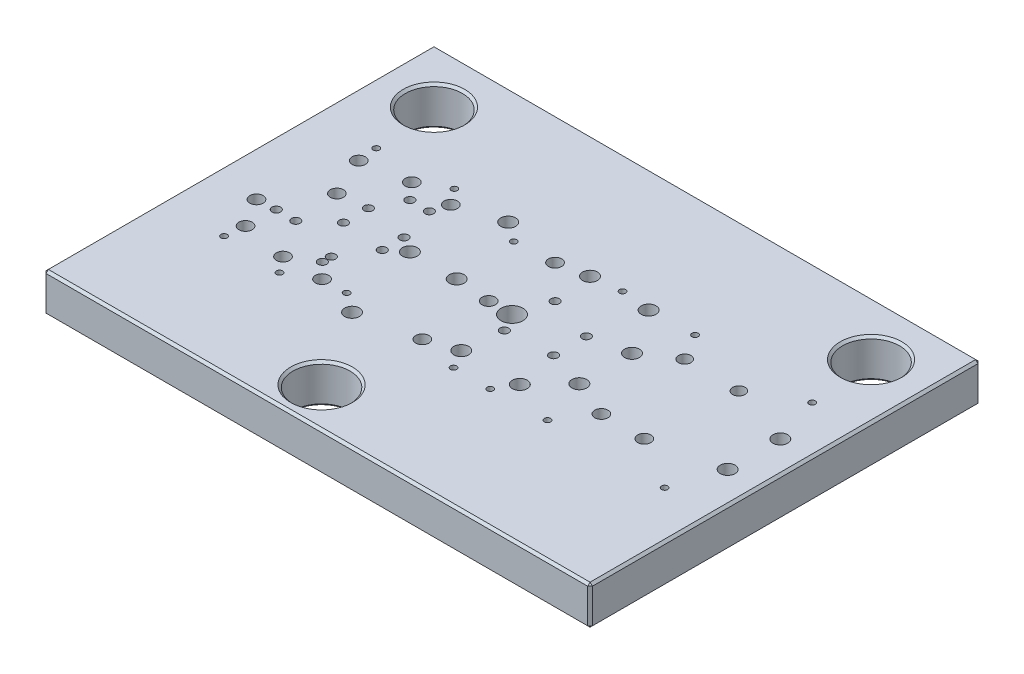
from build123d import *

# Parameters (mm, degrees)
SKETCH1_W                  = 700
SKETCH1_H                  = 500
BOSS_EXTRUDE1_DEPTH        = 50
CUT_EXTRUDE1_REACH         = 435.013
SKETCH2_R                  = 36.5
CHAMFER1_SIZE              = 3
CHAMFER2_SIZE              = 3
M30X2_0_TAPPED_HOLE1_D     = 28
CUT_EXTRUDE2_REACH         = 435.013
SKETCH7_R                  = 6
CUT_EXTRUDE3_REACH         = 435.013
SKETCH8_R                  = 8.5
CUT_EXTRUDE4_REACH         = 435.013
SKETCH9_R                  = 8
SKETCH11_R                 = 9.5
CUT_EXTRUDE5_DEPTH         = 36.8
M10_TAPPED_HOLE1_D         = 8.5
M10_TAPPED_HOLE1_DEPTH     = 27.5
M10_TAPPED_HOLE1_TIP       = 2.553657631
F_8_0MM_DOWEL_HOLE1_D      = 8
M8_TAPPED_HOLE1_D          = 6.8
M8_TAPPED_HOLE1_DEPTH      = 22.25
M8_TAPPED_HOLE1_TIP        = 2.042926105
F_8_0MM_DOWEL_HOLE2_D      = 8
F_11_0_11_DIAMETER_HOLE1_D = 11
SKETCH27_R                 = 6
CUT_EXTRUDE6_DEPTH         = 434.012701892
SKETCH29_R                 = 9.5
CUT_EXTRUDE7_DEPTH         = 36.8
SKETCH30_R                 = 5
CUT_EXTRUDE8_DEPTH         = 434.012701892
SKETCH31_R                 = 8.5
CUT_EXTRUDE9_DEPTH         = 39.8
M8_TAPPED_HOLE2_D          = 6.8
M8_TAPPED_HOLE2_DEPTH      = 22.25
M8_TAPPED_HOLE2_TIP        = 2.042926105
F_8_0MM_DOWEL_HOLE3_D      = 8
SKETCH38_R                 = 6
CUT_EXTRUDE10_DEPTH        = 434.012701892
SKETCH39_R                 = 9.5
CUT_EXTRUDE11_DEPTH        = 36.8
SKETCH40_R                 = 10
CUT_EXTRUDE12_DEPTH        = 9.2
F_10_0_10_DIAMETER_HOLE1_D = 10
SKETCH45_R                 = 8.5
CUT_EXTRUDE13_DEPTH        = 33.8
F_11_0_11_DIAMETER_HOLE2_D = 11
M8_TAPPED_HOLE3_D          = 6.8
M8_TAPPED_HOLE3_DEPTH      = 22.25
M8_TAPPED_HOLE3_TIP        = 2.042926105
F_8_0MM_DOWEL_HOLE4_D      = 8
SKETCH57_R                 = 5
CUT_EXTRUDE14_DEPTH        = 434.012701892
SKETCH58_R                 = 8.5
CUT_EXTRUDE15_DEPTH        = 36.8
F_11_0_11_DIAMETER_HOLE3_D = 11
M8_TAPPED_HOLE4_D          = 6.8
M8_TAPPED_HOLE4_DEPTH      = 22.25
M8_TAPPED_HOLE4_TIP        = 2.042926105
F_8_0MM_DOWEL_HOLE5_D      = 8


with BuildPart() as part:
    # Sketch1 → Boss-Extrude1 (new body)
    with BuildSketch(Plane(origin=(0, 0, 0), x_dir=(1, 0, 0), z_dir=(0, 1, 0))):
        Rectangle(SKETCH1_W, SKETCH1_H)
    extrude(amount=-BOSS_EXTRUDE1_DEPTH)

    # Sketch2 → Cut-Extrude1 (cut, up to next)
    with BuildSketch(Plane(origin=(0, 0, 0), x_dir=(1, 0, 0), z_dir=(0, 1, 0)), mode=Mode.PRIVATE) as cut_extrude1_sk1:
        with Locations((-280, 180)):
            Circle(SKETCH2_R)
    cut_extrude1_tool1 = extrude(cut_extrude1_sk1.sketch, amount=-CUT_EXTRUDE1_REACH, mode=Mode.PRIVATE) & part.part
    # Sketch2 → Cut-Extrude1 (cut, up to next)
    with BuildSketch(Plane(origin=(0, 0, 0), x_dir=(1, 0, 0), z_dir=(0, 1, 0)), mode=Mode.PRIVATE) as cut_extrude1_sk2:
        with Locations((280, 180)):
            Circle(SKETCH2_R)
    cut_extrude1_tool2 = extrude(cut_extrude1_sk2.sketch, amount=-CUT_EXTRUDE1_REACH, mode=Mode.PRIVATE) & part.part
    # Sketch2 → Cut-Extrude1 (cut, up to next)
    with BuildSketch(Plane(origin=(0, 0, 0), x_dir=(1, 0, 0), z_dir=(0, 1, 0)), mode=Mode.PRIVATE) as cut_extrude1_sk3:
        with Locations((-44, -200)):
            Circle(SKETCH2_R)
    cut_extrude1_tool3 = extrude(cut_extrude1_sk3.sketch, amount=-CUT_EXTRUDE1_REACH, mode=Mode.PRIVATE) & part.part
    add(cut_extrude1_tool1.solids().sort_by_distance((-280, 0, -180))[0], mode=Mode.SUBTRACT)
    add(cut_extrude1_tool2.solids().sort_by_distance((280, 0, -180))[0], mode=Mode.SUBTRACT)
    add(cut_extrude1_tool3.solids().sort_by_distance((-44, 0, 200))[0], mode=Mode.SUBTRACT)

    # Chamfer1
    chamfer1_edges = [part.edges().sort_by_distance(p)[0] for p in [
        (243.5, -50, -180),
        (243.5, 0, -180),
        (-316.5, -50, -180),
        (-316.5, 0, -180),
        (-80.5, -50, 200),
        (-80.5, 0, 200),
    ]]
    chamfer(chamfer1_edges, length=CHAMFER1_SIZE)

    # Chamfer2
    chamfer2_edges = [part.edges().sort_by_distance(p)[0] for p in [
        (-350, -25, -250),
        (-350, -25, 250),
        (350, -25, -250),
        (0, -50, -250),
        (-350, -50, 0),
        (0, -50, 250),
        (350, -50, 0),
        (350, -25, 250),
        (350, 0, 0),
        (0, 0, -250),
        (-350, 0, 0),
        (0, 0, 250),
    ]]
    chamfer(chamfer2_edges, length=CHAMFER2_SIZE)

    # M30x2.0 Tapped Hole1 (through all)
    with Locations(Plane(origin=(0, 0, 0), x_dir=(1, 0, 0), z_dir=(0, 1, 0))):
        with Locations((0, 0)):
            Hole(M30X2_0_TAPPED_HOLE1_D / 2)

    # Sketch7 → Cut-Extrude2 (cut, up to next)
    with BuildSketch(Plane(origin=(0, 0, 0), x_dir=(1, 0, 0), z_dir=(0, 1, 0)), mode=Mode.PRIVATE) as cut_extrude2_sk1:
        with Locations((310, 33.75)):
            Circle(SKETCH7_R)
    cut_extrude2_tool1 = extrude(cut_extrude2_sk1.sketch, amount=-CUT_EXTRUDE2_REACH, mode=Mode.PRIVATE) & part.part
    # Sketch7 → Cut-Extrude2 (cut, up to next)
    with BuildSketch(Plane(origin=(0, 0, 0), x_dir=(1, 0, 0), z_dir=(0, 1, 0)), mode=Mode.PRIVATE) as cut_extrude2_sk2:
        with Locations((310, -33.75)):
            Circle(SKETCH7_R)
    cut_extrude2_tool2 = extrude(cut_extrude2_sk2.sketch, amount=-CUT_EXTRUDE2_REACH, mode=Mode.PRIVATE) & part.part
    # Sketch7 → Cut-Extrude2 (cut, up to next)
    with BuildSketch(Plane(origin=(0, 0, 0), x_dir=(1, 0, 0), z_dir=(0, 1, 0)), mode=Mode.PRIVATE) as cut_extrude2_sk3:
        with Locations((120, -33.75)):
            Circle(SKETCH7_R)
    cut_extrude2_tool3 = extrude(cut_extrude2_sk3.sketch, amount=-CUT_EXTRUDE2_REACH, mode=Mode.PRIVATE) & part.part
    # Sketch7 → Cut-Extrude2 (cut, up to next)
    with BuildSketch(Plane(origin=(0, 0, 0), x_dir=(1, 0, 0), z_dir=(0, 1, 0)), mode=Mode.PRIVATE) as cut_extrude2_sk4:
        with Locations((120, 33.75)):
            Circle(SKETCH7_R)
    cut_extrude2_tool4 = extrude(cut_extrude2_sk4.sketch, amount=-CUT_EXTRUDE2_REACH, mode=Mode.PRIVATE) & part.part
    add(cut_extrude2_tool1.solids().sort_by_distance((310, 0, -33.75))[0], mode=Mode.SUBTRACT)
    add(cut_extrude2_tool2.solids().sort_by_distance((310, 0, 33.75))[0], mode=Mode.SUBTRACT)
    add(cut_extrude2_tool3.solids().sort_by_distance((120, 0, 33.75))[0], mode=Mode.SUBTRACT)
    add(cut_extrude2_tool4.solids().sort_by_distance((120, 0, -33.75))[0], mode=Mode.SUBTRACT)

    # Sketch8 → Cut-Extrude3 (cut, up to next)
    with BuildSketch(Plane(origin=(0, 0, 0), x_dir=(1, 0, 0), z_dir=(0, 1, 0)), mode=Mode.PRIVATE) as cut_extrude3_sk1:
        with Locations((222.63, -53.14)):
            Circle(SKETCH8_R)
    cut_extrude3_tool1 = extrude(cut_extrude3_sk1.sketch, amount=-CUT_EXTRUDE3_REACH, mode=Mode.PRIVATE) & part.part
    # Sketch8 → Cut-Extrude3 (cut, up to next)
    with BuildSketch(Plane(origin=(0, 0, 0), x_dir=(1, 0, 0), z_dir=(0, 1, 0)), mode=Mode.PRIVATE) as cut_extrude3_sk2:
        with Locations((167.63, -53.14)):
            Circle(SKETCH8_R)
    cut_extrude3_tool2 = extrude(cut_extrude3_sk2.sketch, amount=-CUT_EXTRUDE3_REACH, mode=Mode.PRIVATE) & part.part
    add(cut_extrude3_tool1.solids().sort_by_distance((222.63, 0, 53.14))[0], mode=Mode.SUBTRACT)
    add(cut_extrude3_tool2.solids().sort_by_distance((167.63, 0, 53.14))[0], mode=Mode.SUBTRACT)

    # Sketch9 → Cut-Extrude4 (cut, up to next)
    with BuildSketch(Plane(origin=(0, 0, 0), x_dir=(1, 0, 0), z_dir=(0, 1, 0)), mode=Mode.PRIVATE) as cut_extrude4_sk1:
        with Locations((160.13, 61.13)):
            Circle(SKETCH9_R)
    cut_extrude4_tool1 = extrude(cut_extrude4_sk1.sketch, amount=-CUT_EXTRUDE4_REACH, mode=Mode.PRIVATE) & part.part
    # Sketch9 → Cut-Extrude4 (cut, up to next)
    with BuildSketch(Plane(origin=(0, 0, 0), x_dir=(1, 0, 0), z_dir=(0, 1, 0)), mode=Mode.PRIVATE) as cut_extrude4_sk2:
        with Locations((230.13, 60.5)):
            Circle(SKETCH9_R)
    cut_extrude4_tool2 = extrude(cut_extrude4_sk2.sketch, amount=-CUT_EXTRUDE4_REACH, mode=Mode.PRIVATE) & part.part
    add(cut_extrude4_tool1.solids().sort_by_distance((160.13, 0, -61.13))[0], mode=Mode.SUBTRACT)
    add(cut_extrude4_tool2.solids().sort_by_distance((230.13, 0, -60.5))[0], mode=Mode.SUBTRACT)

    # Sketch11 → Cut-Extrude5 (cut)
    with BuildSketch(Plane(origin=(0, 0, 0), x_dir=(1, 0, 0), z_dir=(0, 1, 0))):
        with Locations((310, -33.75)):
            Circle(SKETCH11_R)
        with Locations((310, 33.75)):
            Circle(SKETCH11_R)
        with Locations((120, -33.75)):
            Circle(SKETCH11_R)
        with Locations((120, 33.75)):
            Circle(SKETCH11_R)
    extrude(amount=-CUT_EXTRUDE5_DEPTH, mode=Mode.SUBTRACT)

    # M10 Tapped Hole1
    with Locations(Plane(origin=(0, -50, 0), x_dir=(-1, 0, 0), z_dir=(0, -1, 0))):
        with Locations((-307, -94.5), (-123, -94.5), (-123, 94.5), (-307, 94.5)):
            Hole(M10_TAPPED_HOLE1_D / 2, depth=M10_TAPPED_HOLE1_DEPTH)
            with Locations((0, 0, -(M10_TAPPED_HOLE1_DEPTH + M10_TAPPED_HOLE1_TIP / 2))):  # 118° drill point
                Cone(0, M10_TAPPED_HOLE1_D / 2, M10_TAPPED_HOLE1_TIP, mode=Mode.SUBTRACT)

    # Ø8.0mm Dowel Hole1 (through all)
    with Locations(Plane(origin=(0, 0, 0), x_dir=(1, 0, 0), z_dir=(0, 1, 0))):
        with Locations((290, 94.5), (140, 94.5), (290, -94.5), (140, -94.5)):
            Hole(F_8_0MM_DOWEL_HOLE1_D / 2)

    # M8 Tapped Hole1
    with Locations(Plane.XZ.offset(50)):
        with Locations((62.13, -96.5), (28.13, -96.5), (84.13, 96.5), (6.13, 96.5)):
            Hole(M8_TAPPED_HOLE1_D / 2, depth=M8_TAPPED_HOLE1_DEPTH)
            with Locations((0, 0, -(M8_TAPPED_HOLE1_DEPTH + M8_TAPPED_HOLE1_TIP / 2))):  # 118° drill point
                Cone(0, M8_TAPPED_HOLE1_D / 2, M8_TAPPED_HOLE1_TIP, mode=Mode.SUBTRACT)

    # Ø8.0mm Dowel Hole2 (through all)
    with Locations(Plane(origin=(0, 0, 0), x_dir=(1, 0, 0), z_dir=(0, 1, 0))):
        with Locations((68.63, -96.5), (21.63, -96.5), (45.13, 96.5)):
            Hole(F_8_0MM_DOWEL_HOLE2_D / 2)

    # Ø11.0 (11) Diameter Hole1 (through all)
    with Locations(Plane(origin=(0, 0, 0), x_dir=(1, 0, 0), z_dir=(0, 1, 0))):
        with Locations((71.88, -18.64), (12.88, -22.64), (71.88, 23.36), (12.88, 42.36)):
            Hole(F_11_0_11_DIAMETER_HOLE1_D / 2)

    # Sketch27 → Cut-Extrude6 (cut, through all)
    with BuildSketch(Plane(origin=(0, 0, 0), x_dir=(1, 0, 0), z_dir=(0, 1, 0))):
        with Locations((7.63, 92.36)):
            Circle(SKETCH27_R)
        with Locations((82.63, 92.36)):
            Circle(SKETCH27_R)
        with Locations((82.63, -72.64)):
            Circle(SKETCH27_R)
        with Locations((7.63, -72.64)):
            Circle(SKETCH27_R)
    extrude(amount=-CUT_EXTRUDE6_DEPTH, mode=Mode.SUBTRACT)

    # Sketch29 → Cut-Extrude7 (cut)
    with BuildSketch(Plane(origin=(0, 0, 0), x_dir=(1, 0, 0), z_dir=(0, 1, 0))):
        with Locations((7.63, 92.36)):
            Circle(SKETCH29_R)
        with Locations((82.63, 92.36)):
            Circle(SKETCH29_R)
        with Locations((7.63, -72.64)):
            Circle(SKETCH29_R)
        with Locations((82.63, -72.64)):
            Circle(SKETCH29_R)
    extrude(amount=-CUT_EXTRUDE7_DEPTH, mode=Mode.SUBTRACT)

    # Sketch30 → Cut-Extrude8 (cut, through all)
    with BuildSketch(Plane(origin=(0, 0, 0), x_dir=(1, 0, 0), z_dir=(0, 1, 0))):
        with Locations((-29.87, 85)):
            Circle(SKETCH30_R)
        with Locations((-29.87, 0)):
            Circle(SKETCH30_R)
        with Locations((-29.87, -85)):
            Circle(SKETCH30_R)
    extrude(amount=-CUT_EXTRUDE8_DEPTH, mode=Mode.SUBTRACT)

    # Sketch31 → Cut-Extrude9 (cut)
    with BuildSketch(Plane(origin=(0, 0, 0), x_dir=(1, 0, 0), z_dir=(0, 1, 0))):
        with Locations((-29.87, 85)):
            Circle(SKETCH31_R)
        with Locations((-29.87, 0)):
            Circle(SKETCH31_R)
        with Locations((-29.87, -85)):
            Circle(SKETCH31_R)
    extrude(amount=-CUT_EXTRUDE9_DEPTH, mode=Mode.SUBTRACT)

    # M8 Tapped Hole2
    with Locations(Plane(origin=(0, -50, 0), x_dir=(-1, 0, 0), z_dir=(0, -1, 0))):
        with Locations((79.87, -97.5), (129.87, -97.5), (79.87, 97.5), (129.87, 97.5)):
            Hole(M8_TAPPED_HOLE2_D / 2, depth=M8_TAPPED_HOLE2_DEPTH)
            with Locations((0, 0, -(M8_TAPPED_HOLE2_DEPTH + M8_TAPPED_HOLE2_TIP / 2))):  # 118° drill point
                Cone(0, M8_TAPPED_HOLE2_D / 2, M8_TAPPED_HOLE2_TIP, mode=Mode.SUBTRACT)

    # Ø8.0mm Dowel Hole3 (through all)
    with Locations(Plane(origin=(0, 0, 0), x_dir=(1, 0, 0), z_dir=(0, 1, 0))):
        with Locations((-79.87, 81.975), (-129.87, -82)):
            Hole(F_8_0MM_DOWEL_HOLE3_D / 2)

    # Sketch38 → Cut-Extrude10 (cut, through all)
    with BuildSketch(Plane(origin=(0, 0, 0), x_dir=(1, 0, 0), z_dir=(0, 1, 0))):
        with Locations((-104.87, 100)):
            Circle(SKETCH38_R)
        with Locations((-104.87, -100)):
            Circle(SKETCH38_R)
        with Locations((-74.87, 4)):
            Circle(SKETCH38_R)
        with Locations((-134.87, 4)):
            Circle(SKETCH38_R)
    extrude(amount=-CUT_EXTRUDE10_DEPTH, mode=Mode.SUBTRACT)

    # Sketch39 → Cut-Extrude11 (cut)
    with BuildSketch(Plane(origin=(0, 0, 0), x_dir=(1, 0, 0), z_dir=(0, 1, 0))):
        with Locations((-104.87, 100)):
            Circle(SKETCH39_R)
        with Locations((-104.87, -100)):
            Circle(SKETCH39_R)
        with Locations((-74.87, 4)):
            Circle(SKETCH39_R)
        with Locations((-134.87, 4)):
            Circle(SKETCH39_R)
    extrude(amount=-CUT_EXTRUDE11_DEPTH, mode=Mode.SUBTRACT)

    # Sketch40 → Cut-Extrude12 (cut)
    with BuildSketch(Plane.XZ.offset(50)):
        with Locations((-185.87, -82.5)):
            Circle(SKETCH40_R)
        with Locations((-210.87, 82.5)):
            Circle(SKETCH40_R)
        with Locations((-185.87, 82.5)):
            Circle(SKETCH40_R)
        with Locations((-160.87, 82.5)):
            Circle(SKETCH40_R)
        with Locations((-160.87, 33)):
            Circle(SKETCH40_R)
        with Locations((-210.87, 33)):
            Circle(SKETCH40_R)
        with Locations((-160.87, -39)):
            Circle(SKETCH40_R)
        with Locations((-160.87, -82.5)):
            Circle(SKETCH40_R)
        with Locations((-210.87, -82.5)):
            Circle(SKETCH40_R)
        with Locations((-210.87, -47)):
            Circle(SKETCH40_R)
    extrude(amount=-CUT_EXTRUDE12_DEPTH, mode=Mode.SUBTRACT)

    # Ø10.0 (10) Diameter Hole1 (through all)
    with Locations(Plane(origin=(0, 0, 0), x_dir=(1, 0, 0), z_dir=(0, 1, 0))):
        with Locations((-160.87, 82.5), (-210.87, 82.5), (-160.87, -82.5), (-210.87, -82.5)):
            Hole(F_10_0_10_DIAMETER_HOLE1_D / 2)

    # Sketch45 → Cut-Extrude13 (cut)
    with BuildSketch(Plane(origin=(0, 0, 0), x_dir=(1, 0, 0), z_dir=(0, 1, 0))):
        with Locations((-160.87, 82.5)):
            Circle(SKETCH45_R)
        with Locations((-210.87, 82.5)):
            Circle(SKETCH45_R)
        with Locations((-160.87, -82.5)):
            Circle(SKETCH45_R)
        with Locations((-210.87, -82.5)):
            Circle(SKETCH45_R)
    extrude(amount=-CUT_EXTRUDE13_DEPTH, mode=Mode.SUBTRACT)

    # Ø11.0 (11) Diameter Hole2 (through all)
    with Locations(Plane(origin=(0, 0, 0), x_dir=(1, 0, 0), z_dir=(0, 1, 0))):
        with Locations((-167.37, 61.5), (-192.37, 61.5), (-154.62, 16.36), (-209.87, 25.86), (-209.87, -6.14), (-179.87, -51.64), (-179.87, -63.14), (-154.62, -11.64)):
            Hole(F_11_0_11_DIAMETER_HOLE2_D / 2)

    # M8 Tapped Hole3
    with Locations(Plane(origin=(0, -50, 0), x_dir=(-1, 0, 0), z_dir=(0, -1, 0))):
        with Locations((160.87, -102.5), (210.87, -102.5), (160.87, 102.5), (210.87, 102.5)):
            Hole(M8_TAPPED_HOLE3_D / 2, depth=M8_TAPPED_HOLE3_DEPTH)
            with Locations((0, 0, -(M8_TAPPED_HOLE3_DEPTH + M8_TAPPED_HOLE3_TIP / 2))):  # 118° drill point
                Cone(0, M8_TAPPED_HOLE3_D / 2, M8_TAPPED_HOLE3_TIP, mode=Mode.SUBTRACT)

    # Ø8.0mm Dowel Hole4 (through all)
    with Locations(Plane(origin=(0, 0, 0), x_dir=(1, 0, 0), z_dir=(0, 1, 0))):
        with Locations((-176.37, 102.5), (-195.37, -102.5)):
            Hole(F_8_0MM_DOWEL_HOLE4_D / 2)

    # Sketch57 → Cut-Extrude14 (cut, through all)
    with BuildSketch(Plane(origin=(0, 0, 0), x_dir=(1, 0, 0), z_dir=(0, 1, 0))):
        with Locations((-268.87, -72.5)):
            Circle(SKETCH57_R)
        with Locations((-291.37, -36)):
            Circle(SKETCH57_R)
        with Locations((-246.37, 22)):
            Circle(SKETCH57_R)
        with Locations((-268.87, 72.5)):
            Circle(SKETCH57_R)
    extrude(amount=-CUT_EXTRUDE14_DEPTH, mode=Mode.SUBTRACT)

    # Sketch58 → Cut-Extrude15 (cut)
    with BuildSketch(Plane(origin=(0, 0, 0), x_dir=(1, 0, 0), z_dir=(0, 1, 0))):
        with Locations((-268.87, 72.5)):
            Circle(SKETCH58_R)
        with Locations((-246.37, 22)):
            Circle(SKETCH58_R)
        with Locations((-291.37, -36)):
            Circle(SKETCH58_R)
        with Locations((-268.87, -72.5)):
            Circle(SKETCH58_R)
    extrude(amount=-CUT_EXTRUDE15_DEPTH, mode=Mode.SUBTRACT)

    # Ø11.0 (11) Diameter Hole3 (through all)
    with Locations(Plane(origin=(0, 0, 0), x_dir=(1, 0, 0), z_dir=(0, 1, 0))):
        with Locations((-267.37, -34.64), (-242.37, -34.64)):
            Hole(F_11_0_11_DIAMETER_HOLE3_D / 2)

    # M8 Tapped Hole4
    with Locations(Plane.XZ.offset(50)):
        with Locations((-291.37, -97.5), (-251.37, -97.5), (-251.37, 97.5), (-291.37, 97.5)):
            Hole(M8_TAPPED_HOLE4_D / 2, depth=M8_TAPPED_HOLE4_DEPTH)
            with Locations((0, 0, -(M8_TAPPED_HOLE4_DEPTH + M8_TAPPED_HOLE4_TIP / 2))):  # 118° drill point
                Cone(0, M8_TAPPED_HOLE4_D / 2, M8_TAPPED_HOLE4_TIP, mode=Mode.SUBTRACT)

    # Ø8.0mm Dowel Hole5 (through all)
    with Locations(Plane(origin=(0, 0, 0), x_dir=(1, 0, 0), z_dir=(0, 1, 0))):
        with Locations((-271.37, -97.5), (-271.37, 97.5)):
            Hole(F_8_0MM_DOWEL_HOLE5_D / 2)


solid = part.part
